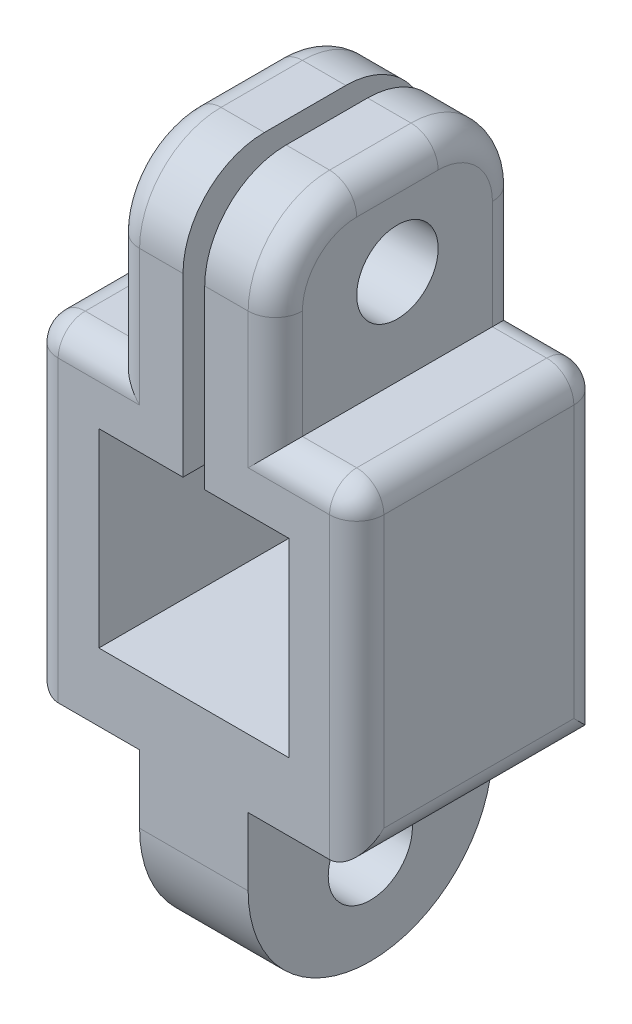
from build123d import *

# Parameters (mm, degrees)
SKETCH_1_W          = 3
SKETCH_1_H          = 7
SKETCH_1_W_2        = 12
SKETCH_1_H_2        = 12
SKETCH_1_W_3        = 7
SKETCH_1_W_4        = 5
EXTRUDE_1_DEPTH     = 9
CUT_EXTRUDE_1_DEPTH = 17.911534525
FILLET_2_R          = 3
SKETCH_4_R          = 1.5
CUT_EXTRUDE_3_DEPTH = 19.193405399
FILLET_3_R          = 1
FILLET_4_R          = 1
FILLET_5_R          = 1
SKETCH_5_W          = 5
SKETCH_5_H          = 7
CUT_EXTRUDE_4_DEPTH = 9
EXTRUDE_2_DEPTH     = 7
FILLET_6_R          = 4.5
SKETCH_7_R          = 1.55
CUT_EXTRUDE_5_DEPTH = 4


# Some blends are built 0.0001 mm under size
with BuildPart() as part:
    # 草图1 → 凸台-拉伸1 (new body)
    # profile 1 of 4: a face of its own
    with BuildSketch(Plane.XY):
        with Locations((-1.5, 9.5)):
            Rectangle(SKETCH_1_W, SKETCH_1_H)
    # profile 2 of 4: a face of its own
    with BuildSketch(Plane.XY):
        with Locations((1.5, 9.5)):
            Rectangle(SKETCH_1_W, SKETCH_1_H)
    # profile 3 of 4: a face of its own
    with BuildSketch(Plane.XY):
        Rectangle(SKETCH_1_W_2, SKETCH_1_H_2)
        Rectangle(SKETCH_1_W_3, SKETCH_1_H, mode=Mode.SUBTRACT)
    # profile 4 of 4: a face of its own
    with BuildSketch(Plane.XY):
        with Locations((1, -9.5)):
            Rectangle(SKETCH_1_W_4, SKETCH_1_H)
    extrude(amount=EXTRUDE_1_DEPTH)

    # 草图2 → 切除-拉伸1 (cut, through all)
    with BuildSketch(Plane.XY.offset(9)):
        Polygon((0, 13), (0.4, 13), (0.4, 3.5), (0, 3.5), (-0.4, 3.5), (-0.4, 13), align=None)
    extrude(amount=-CUT_EXTRUDE_1_DEPTH, mode=Mode.SUBTRACT)

    # 圆角2
    fillet_2_edges = [part.edges().sort_by_distance(p)[0] for p in [
        (1.7, 13, 9),
        (1.7, 13, 0),
        (-1.7, 13, 0),
        (-1.7, 13, 9),
    ]]
    fillet(fillet_2_edges, radius=FILLET_2_R)

    # 草图4 → 切除-拉伸3 (cut, through all)
    with BuildSketch(Plane(origin=(3, 0, 0), x_dir=(0, 0, -1), z_dir=(1, 0, 0))):
        with Locations((-4.5, 9.5)):
            Circle(SKETCH_4_R)
    extrude(amount=-CUT_EXTRUDE_3_DEPTH, mode=Mode.SUBTRACT)

    # 圆角3
    fillet_3_edges = [part.edges().sort_by_distance(p)[0] for p in [
        (3, 8, 9),
        (6, 0, 0),
        (3, 8, 0),
        (4.5, 6, 0),
        (6, 6, 4.5),
        (6, -6, 4.5),
        (4.5, 6, 9),
        (6, 0, 9),
        (3, 13, 4.5),
        (3, 12.121320344, 8.121320344),
        (3, 12.121320344, 0.878679656),
    ]]
    fillet(fillet_3_edges, radius=FILLET_3_R)

    # 圆角4
    fillet_4_edges = [part.edges().sort_by_distance(p)[0] for p in [
        (-3, 8, 9),
        (-6, 0, 0),
        (-4.5, 6, 0),
        (-3, 8, 0),
        (-4.5, 6, 9),
        (-6, 0, 9),
        (-6, -6, 4.5),
        (-3, 13, 4.5),
        (-3, 12.121320344, 8.121320344),
        (-3, 12.121320344, 0.878679656),
    ]]
    fillet(fillet_4_edges, radius=FILLET_4_R)

    # 圆角5
    # the kernel refuses this fillet: 1 mm, written as the material it takes off along each edge
    with BuildSketch(Plane(origin=(-5, 5, 8), x_dir=(0, 1, 0), z_dir=(-1, 0, 0))) as fillet_5_piece_1_section:
        Polygon((0, 0), (FILLET_5_R, 0), (FILLET_5_R, -FILLET_5_R), (0, -FILLET_5_R), align=None)
    fillet_5_piece_1 = extrude(amount=FILLET_5_R, mode=Mode.PRIVATE)
    fillet_5_piece_1 = fillet_5_piece_1 - Plane(origin=(-5, 5, 8), x_dir=(0, -0.7071067811865475, -0.7071067811865475), z_dir=(-1, 0, 0)) * Sphere(FILLET_5_R, mode=Mode.PRIVATE)
    add(fillet_5_piece_1, mode=Mode.SUBTRACT)
    with BuildSketch(Plane(origin=(-5, 5, 1), x_dir=(0, 1, 0), z_dir=(-1, 0, 0))) as fillet_5_piece_2_section:
        Polygon((0, 0), (FILLET_5_R, 0), (FILLET_5_R, FILLET_5_R), (0, FILLET_5_R), align=None)
    fillet_5_piece_2 = extrude(amount=FILLET_5_R, mode=Mode.PRIVATE)
    fillet_5_piece_2 = fillet_5_piece_2 - Plane(origin=(-5, 5, 1), x_dir=(0, -0.7071067811865475, 0.7071067811865475), z_dir=(-1, 0, 0)) * Sphere(FILLET_5_R, mode=Mode.PRIVATE)
    add(fillet_5_piece_2, mode=Mode.SUBTRACT)
    with BuildSketch(Plane(origin=(-6, 6, 1), x_dir=(0, -1, 0), z_dir=(0, 0, 1))) as fillet_5_piece_3:
        with BuildLine():
            CenterArc((FILLET_5_R, FILLET_5_R), FILLET_5_R, 180, 90)
            Line((0, FILLET_5_R), (0, 0))
            Line((0, 0), (FILLET_5_R, 0))
        make_face()
    extrude(amount=7, mode=Mode.SUBTRACT)

    # 草图5 → 切除-拉伸4 (cut)
    with BuildSketch(Plane.XY.offset(9)):
        with Locations((1, -9.5)):
            Rectangle(SKETCH_5_W, SKETCH_5_H)
    extrude(amount=-CUT_EXTRUDE_4_DEPTH, mode=Mode.SUBTRACT)

    # 草图6 → 凸台-拉伸2 (add)
    with BuildSketch(Plane.XZ.offset(6)):
        Polygon((0, 9), (-2, 9), (-2, 0), (0, 0), (2, 0), (2, 9), align=None)
    extrude(amount=EXTRUDE_2_DEPTH)

    # 圆角6
    fillet_6_edges = [part.edges().sort_by_distance(p)[0] for p in [
        (0, -13, 0),
        (0, -13, 9),
    ]]
    fillet(fillet_6_edges, radius=FILLET_6_R - 0.0001)  # a hair under: the kernel refuses the full size

    # 草图7 → 切除-拉伸5 (cut)
    with BuildSketch(Plane.ZY.offset(2)):
        with Locations((4.5, -9.5)):
            Circle(SKETCH_7_R)
    extrude(amount=-CUT_EXTRUDE_5_DEPTH, mode=Mode.SUBTRACT)


solid = part.part
